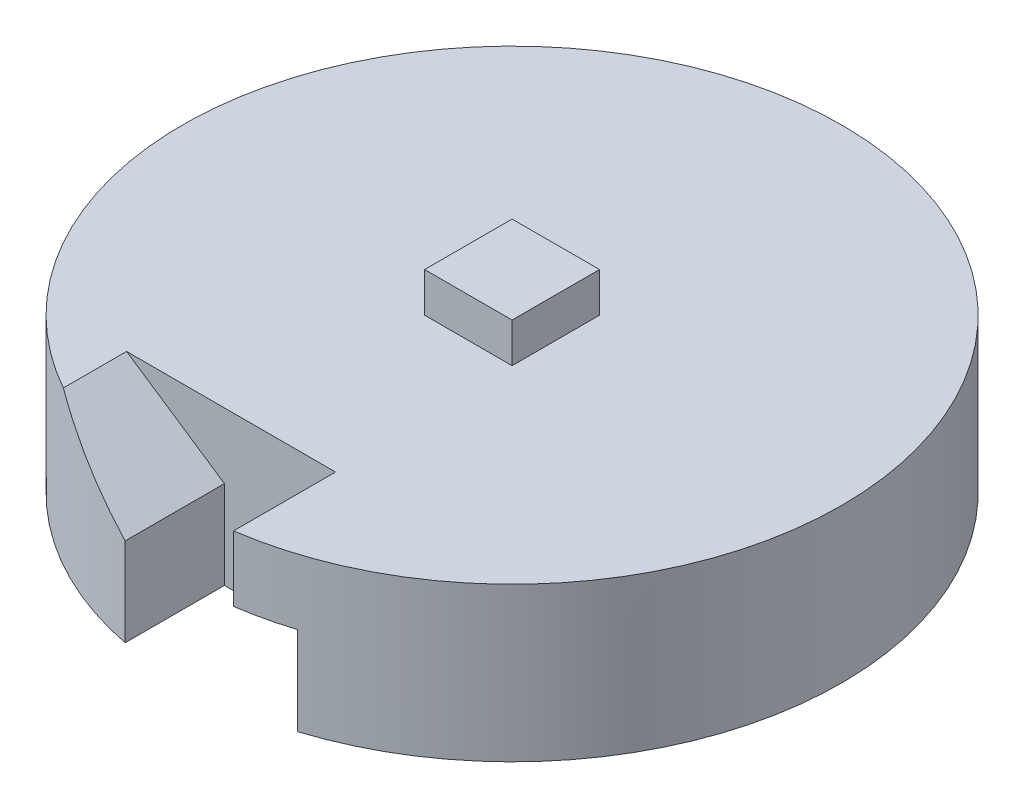
from build123d import *

# Parameters (mm, degrees)
SKETCH1_R           = 37.5
BOSS_EXTRUDE1_DEPTH = 17.5
CUT_EXTRUDE3_DEPTH  = 12
SKETCH9_W           = 9.95
SKETCH9_H           = 9.95
BOSS_EXTRUDE2_DEPTH = 22
SKETCH2_R           = 5
CUT_EXTRUDE5_DEPTH  = 8


with BuildPart() as part:
    # Sketch1 → Boss-Extrude1 (new body)
    with BuildSketch(Plane(origin=(0, 0, 0), x_dir=(1, 0, 0), z_dir=(0, 1, 0))):
        Circle(SKETCH1_R)
    extrude(amount=BOSS_EXTRUDE1_DEPTH)

    # Sketch7 → Cut-Extrude3 (cut)
    with BuildSketch(Plane.XY.offset(37.5)):
        Polygon((5.409167976, 17.669921883), (-18.615329351, 17.669921883), (-7.232029952, 10.040131917), (-7.232029952, -0.186148413), (11.337754855, -0.186148413), (11.337754855, 10.05869391), (5.409167976, 10.05869391), align=None)
    extrude(amount=-CUT_EXTRUDE3_DEPTH, mode=Mode.SUBTRACT)

    # Sketch9 → Boss-Extrude2 (add)
    with BuildSketch(Plane(origin=(0, 0, 0), x_dir=(1, 0, 0), z_dir=(0, 1, 0))):
        Rectangle(SKETCH9_W, SKETCH9_H)
    extrude(amount=BOSS_EXTRUDE2_DEPTH)

    # Sketch2 → Cut-Extrude5 (cut)
    with BuildSketch(Plane.XZ):
        Circle(SKETCH2_R)
    extrude(amount=-CUT_EXTRUDE5_DEPTH, mode=Mode.SUBTRACT)


solid = part.part
